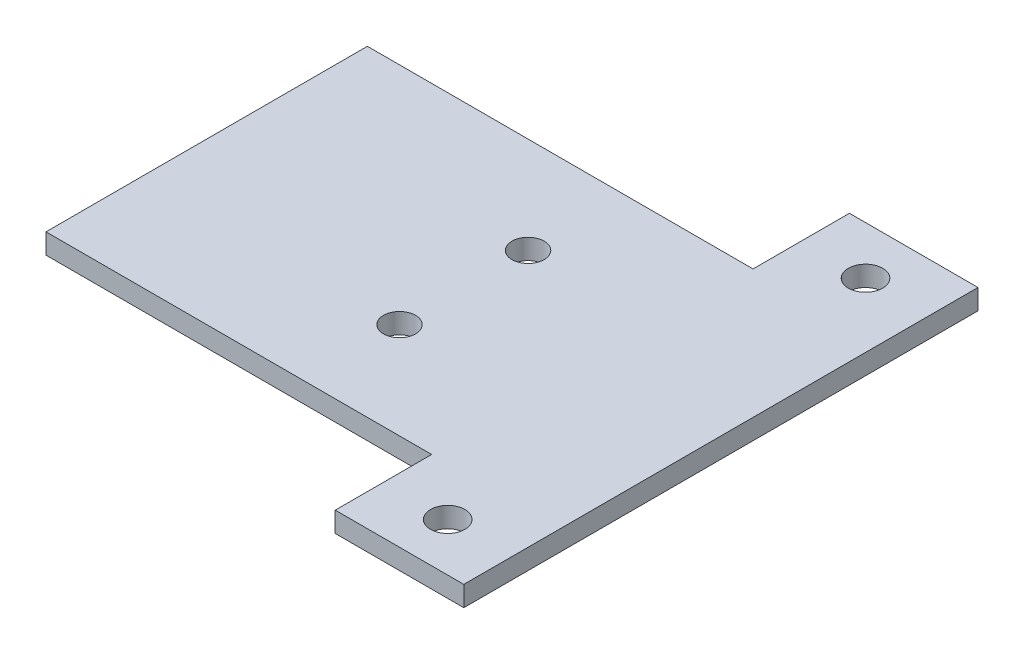
from build123d import *

# Parameters (mm, degrees)
SKETCH1_R           = 1.7
SKETCH1_R_2         = 1.5875
BOSS_EXTRUDE1_DEPTH = 2


with BuildPart() as part:
    # Sketch1 → Boss-Extrude1 (new body)
    with BuildSketch(Plane(origin=(0, 0, 0), x_dir=(1, 0, 0), z_dir=(0, 1, 0))):
        Polygon((-25.4, 15.875), (12.7, 15.875), (12.7, 25.4), (25.4, 25.4), (25.4, -25.4), (12.7, -25.4), (12.7, -15.875), (-25.4, -15.875), align=None)
        with Locations((19.05, 20.6375)):
            Circle(SKETCH1_R, mode=Mode.SUBTRACT)
        with Locations((19.05, -20.6375)):
            Circle(SKETCH1_R, mode=Mode.SUBTRACT)
        with Locations((0, 6.35)):
            Circle(SKETCH1_R_2, mode=Mode.SUBTRACT)
        with Locations((0, -6.35)):
            Circle(SKETCH1_R_2, mode=Mode.SUBTRACT)
    extrude(amount=BOSS_EXTRUDE1_DEPTH)


solid = part.part
